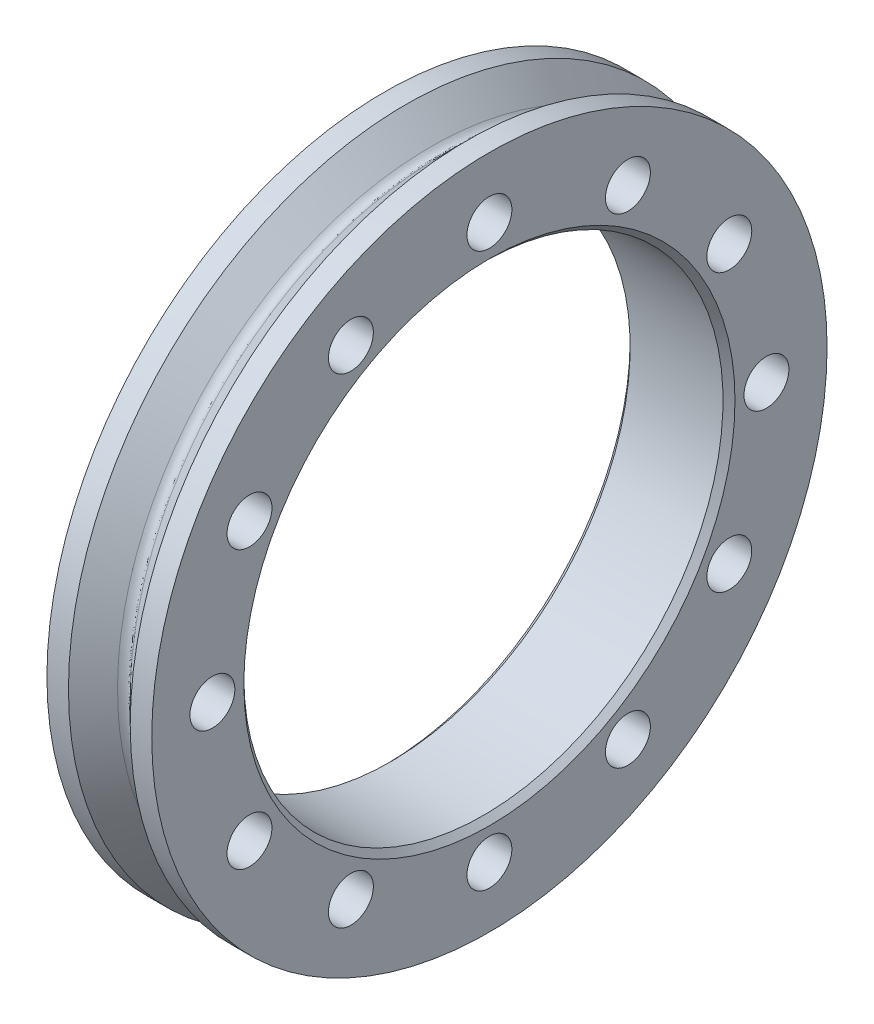
from build123d import *

# Parameters (mm, degrees)
CHAMFER1_SIZE                            = 2
FILLET1_SIZE                             = 3
CBORE_FOR_M10_HEX_HEAD_BOLT1_D           = 10.5
CBORE_FOR_M10_HEX_HEAD_BOLT1_CBORE_D     = 15
CBORE_FOR_M10_HEX_HEAD_BOLT1_CBORE_DEPTH = 10.8
CIRPATTERN1_COUNT                        = 12


with BuildPart() as part:
    # Sketch1 → Revolve1 (revolve)
    with BuildSketch(Plane.XY, mode=Mode.PRIVATE) as revolve1_sk:
        Polygon((17.5, 80), (17.5, 112.75), (10.313708499, 112.75), (0, 102.436291501), (-10.313708499, 112.75), (-17.5, 112.75), (-17.5, 80), align=None)
    revolve(revolve1_sk.sketch.rotate(Axis((0, 0, 0), (-1, 0, 0)), 90), axis=Axis((0, 0, 0), (-1, 0, 0)))

    # Chamfer1
    chamfer1_edges = [part.edges().sort_by_distance(p)[0] for p in [
        (17.5, 0, 80),
        (-17.5, 0, 80),
    ]]
    chamfer(chamfer1_edges, length=CHAMFER1_SIZE)

    # Fillet1
    # a fillet whose section is not a circle: 3 mm, written as the material it adds along each edge
    with BuildSketch(Plane(origin=(0, 0, 0), x_dir=(0, 0, -1), z_dir=(0, 1, 0))) as fillet1_piece_1:
        with BuildLine():
            add(Edge.make_bspline([(102.436291501 + FILLET1_SIZE * 0.707106781187, FILLET1_SIZE * 0.707106781187), (102.436291501 + FILLET1_SIZE * 0.588172798365, FILLET1_SIZE * 0.588172798365), (102.436291501 + FILLET1_SIZE * 0.469238815543, FILLET1_SIZE * 0.469238815543), (102.436291501 + FILLET1_SIZE * 0.257800623859, FILLET1_SIZE * 0.156412938514), (102.436291501 + FILLET1_SIZE * 0.257800623859, -FILLET1_SIZE * 0.156412938514), (102.436291501 + FILLET1_SIZE * 0.469238815543, -FILLET1_SIZE * 0.469238815543), (102.436291501 + FILLET1_SIZE * 0.588172798365, -FILLET1_SIZE * 0.588172798365), (102.436291501 + FILLET1_SIZE * 0.707106781187, -FILLET1_SIZE * 0.707106781187)], knots=[0, 0, 0, 0, 0, 0, 0.5, 0.5, 1, 1, 1, 1, 1, 1], degree=5))
            Line((102.436291501 + FILLET1_SIZE * 0.707106781187, -FILLET1_SIZE * 0.707106781187), (102.436291501, 0))
            Line((102.436291501, 0), (102.436291501 + FILLET1_SIZE * 0.707106781187, FILLET1_SIZE * 0.707106781187))
        make_face()
    revolve(axis=Axis((0, 0, 0), (-1, 0, 0)))

    # CBORE for M10 Hex Head Bolt1 (through all)
    with Locations(Plane(origin=(17.5, -92.5, 0), x_dir=(0, 0, 1), z_dir=(1, 0, 0))):
        with Locations((0, 0)):
            cbore_for_m10_hex_head_bolt1 = CounterBoreHole(CBORE_FOR_M10_HEX_HEAD_BOLT1_D / 2, CBORE_FOR_M10_HEX_HEAD_BOLT1_CBORE_D / 2, CBORE_FOR_M10_HEX_HEAD_BOLT1_CBORE_DEPTH)

    # CirPattern1: CBORE for M10 Hex Head Bolt1 ×12 about axis
    cirpattern1_axis = Axis((0, 0, 0), (1, 0, 0))
    for i in range(1, CIRPATTERN1_COUNT):
        add(cbore_for_m10_hex_head_bolt1.rotate(cirpattern1_axis, i * 360 / CIRPATTERN1_COUNT), mode=Mode.SUBTRACT)


solid = part.part
